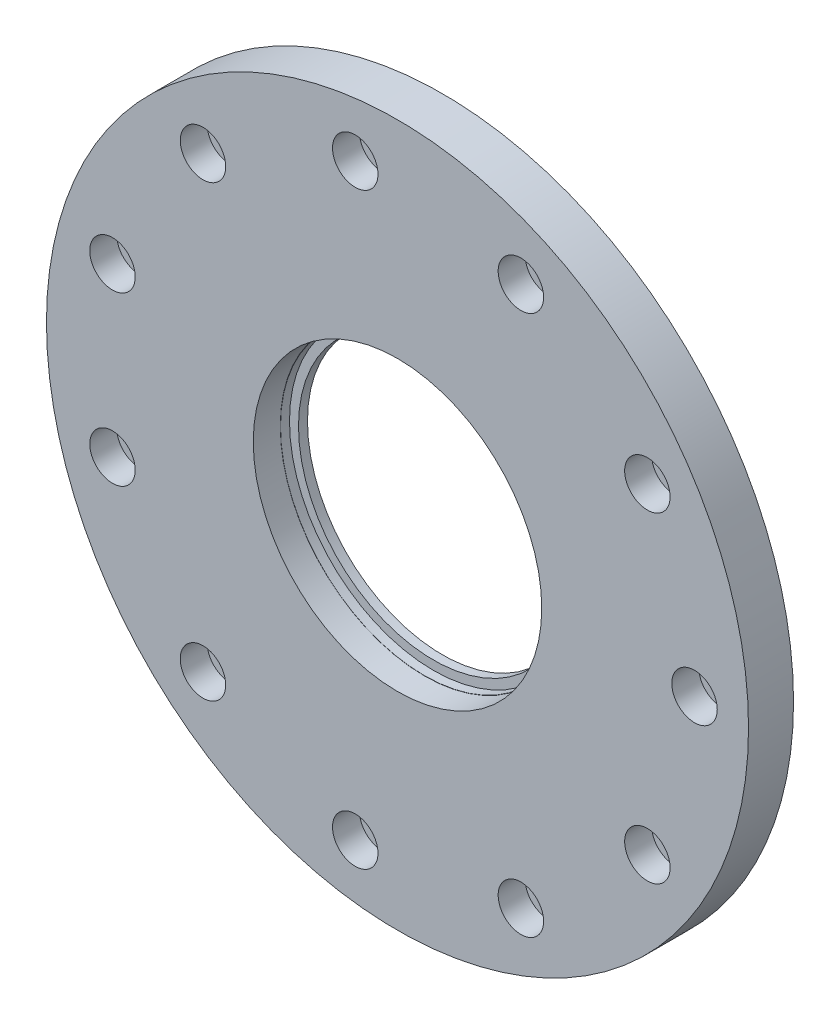
from build123d import *

# Parameters (mm, degrees)
SKETCH1_R           = 39
SKETCH1_R_2         = 2.525
SKETCH1_R_3         = 16.025
BOSS_EXTRUDE1_DEPTH = 3
BOSS_EXTRUDE2_START = 2
SKETCH2_R           = 39
SKETCH2_R_2         = 16
BOSS_EXTRUDE2_DEPTH = 2
SKETCH3_R           = 1.6
CUT_EXTRUDE1_DEPTH  = 56.380501984
SKETCH4_R           = 16
SKETCH4_R_2         = 15
BOSS_EXTRUDE3_DEPTH = 1


with BuildPart() as part:
    # Sketch1 → Boss-Extrude1 (new body)
    with BuildSketch(Plane.XY):
        Circle(SKETCH1_R)
        with Locations((33, 0)):
            Circle(SKETCH1_R_2, mode=Mode.SUBTRACT)
        with Locations((27.761366583, -17.841146976)):
            Circle(SKETCH1_R_2, mode=Mode.SUBTRACT)
        with Locations((13.708695429, -30.017855847)):
            Circle(SKETCH1_R_2, mode=Mode.SUBTRACT)
        with Locations((-4.696389663, -32.664107582)):
            Circle(SKETCH1_R_2, mode=Mode.SUBTRACT)
        with Locations((-21.61040422, -24.939735954)):
            Circle(SKETCH1_R_2, mode=Mode.SUBTRACT)
        with Locations((-31.663268129, -9.297174376)):
            Circle(SKETCH1_R_2, mode=Mode.SUBTRACT)
        with Locations((-31.663268129, 9.297174376)):
            Circle(SKETCH1_R_2, mode=Mode.SUBTRACT)
        with Locations((-21.61040422, 24.939735954)):
            Circle(SKETCH1_R_2, mode=Mode.SUBTRACT)
        with Locations((-4.696389663, 32.664107582)):
            Circle(SKETCH1_R_2, mode=Mode.SUBTRACT)
        with Locations((13.708695429, 30.017855847)):
            Circle(SKETCH1_R_2, mode=Mode.SUBTRACT)
        with Locations((27.761366583, 17.841146976)):
            Circle(SKETCH1_R_2, mode=Mode.SUBTRACT)
        Circle(SKETCH1_R_3, mode=Mode.SUBTRACT)
    extrude(amount=BOSS_EXTRUDE1_DEPTH)

    # Sketch2 → Boss-Extrude2 (add)
    with BuildSketch(Plane(origin=(0, 0, 0), x_dir=(-1, 0, 0), z_dir=(0, 0, -1)).offset(BOSS_EXTRUDE2_START)):
        Circle(SKETCH2_R)
        Circle(SKETCH2_R_2, mode=Mode.SUBTRACT)
    extrude(amount=-BOSS_EXTRUDE2_DEPTH)

    # Sketch3 → Cut-Extrude1 (cut, through all)
    with BuildSketch(Plane.XY.offset(3)):
        with Locations((33, 0)):
            Circle(SKETCH3_R)
        with Locations((27.761366583, -17.841146976)):
            Circle(SKETCH3_R)
        with Locations((13.708695429, -30.017855847)):
            Circle(SKETCH3_R)
        with Locations((-4.696389663, -32.664107582)):
            Circle(SKETCH3_R)
        with Locations((-21.61040422, -24.939735954)):
            Circle(SKETCH3_R)
        with Locations((-31.663268129, -9.297174376)):
            Circle(SKETCH3_R)
        with Locations((-31.663268129, 9.297174376)):
            Circle(SKETCH3_R)
        with Locations((-21.61040422, 24.939735954)):
            Circle(SKETCH3_R)
        with Locations((-4.696389663, 32.664107582)):
            Circle(SKETCH3_R)
        with Locations((13.708695429, 30.017855847)):
            Circle(SKETCH3_R)
        with Locations((27.761366583, 17.841146976)):
            Circle(SKETCH3_R)
    extrude(amount=-CUT_EXTRUDE1_DEPTH, mode=Mode.SUBTRACT)

    # Sketch4 → Boss-Extrude3 (add)
    with BuildSketch(Plane(origin=(0, 0, -2), x_dir=(-1, 0, 0), z_dir=(0, 0, -1))):
        Circle(SKETCH4_R)
        Circle(SKETCH4_R_2, mode=Mode.SUBTRACT)
    extrude(amount=-BOSS_EXTRUDE3_DEPTH)


solid = part.part
